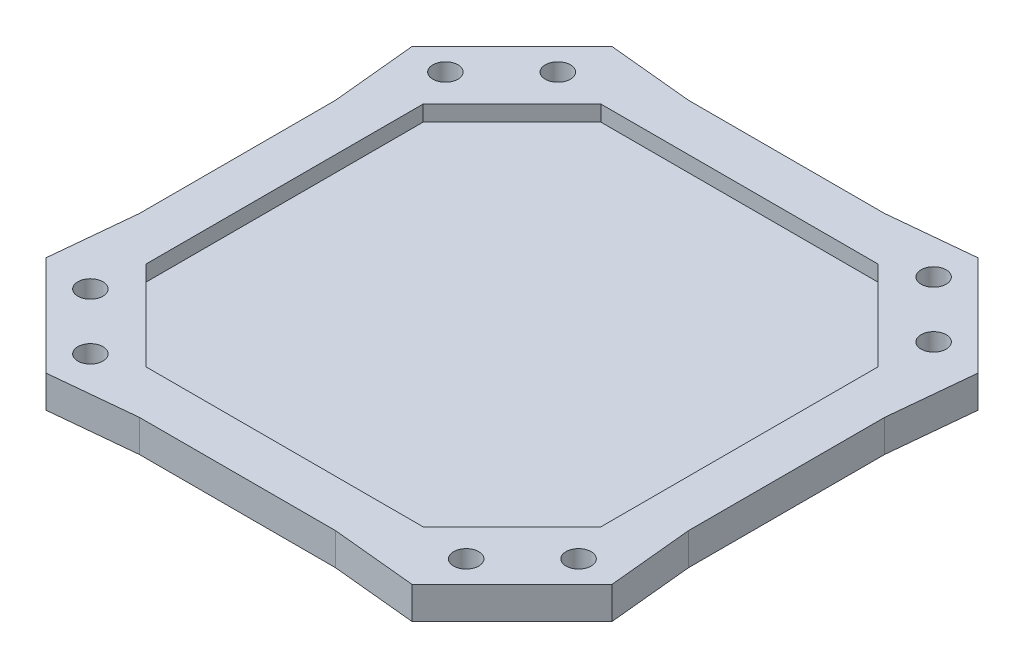
from build123d import *

# Parameters (mm, degrees)
SKETCH1_R           = 1.6
BOSS_EXTRUDE2_DEPTH = 4.1
CUT_EXTRUDE1_DEPTH  = 2


with BuildPart() as part:
    # Sketch1 → Boss-Extrude2 (new body)
    with BuildSketch(Plane(origin=(0, 0, 0), x_dir=(1, 0, 0), z_dir=(0, 1, 0))):
        Polygon((-12.5, 35), (12.5, 35), (23.334523779, 36.062445841), (36.062445841, 23.334523779), (35, 12.5), (35, -12.5), (36.062445841, -23.334523779), (23.334523779, -36.062445841), (12.5, -35), (-12.5, -35), (-23.334523779, -36.062445841), (-36.062445841, -23.334523779), (-35, -12.5), (-35, 12.5), (-36.062445841, 23.334523779), (-23.334523779, 36.062445841), align=None)
        with Locations((22.627416998, 31.112698372)):
            Circle(SKETCH1_R, mode=Mode.SUBTRACT)
        with Locations((29.79056362, 23.94955175)):
            Circle(SKETCH1_R, mode=Mode.SUBTRACT)
        with Locations((31.112698372, -22.627416998)):
            Circle(SKETCH1_R, mode=Mode.SUBTRACT)
        with Locations((23.94955175, -29.79056362)):
            Circle(SKETCH1_R, mode=Mode.SUBTRACT)
        with Locations((-22.627416998, -31.112698372)):
            Circle(SKETCH1_R, mode=Mode.SUBTRACT)
        with Locations((-29.79056362, -23.94955175)):
            Circle(SKETCH1_R, mode=Mode.SUBTRACT)
        with Locations((-31.112698372, 22.627416998)):
            Circle(SKETCH1_R, mode=Mode.SUBTRACT)
        with Locations((-23.94955175, 29.79056362)):
            Circle(SKETCH1_R, mode=Mode.SUBTRACT)
    extrude(amount=BOSS_EXTRUDE2_DEPTH)

    # Sketch2 → Cut-Extrude1 (cut)
    with BuildSketch(Plane(origin=(0, 4.1, 0), x_dir=(1, 0, 0), z_dir=(0, 1, 0))):
        Polygon((-17.669047558, 29), (17.669047558, 29), (29, 17.669047558), (29, -17.669047558), (17.669047558, -29), (-17.669047558, -29), (-29, -17.669047558), (-29, 17.669047558), align=None)
    extrude(amount=-CUT_EXTRUDE1_DEPTH, mode=Mode.SUBTRACT)


solid = part.part
